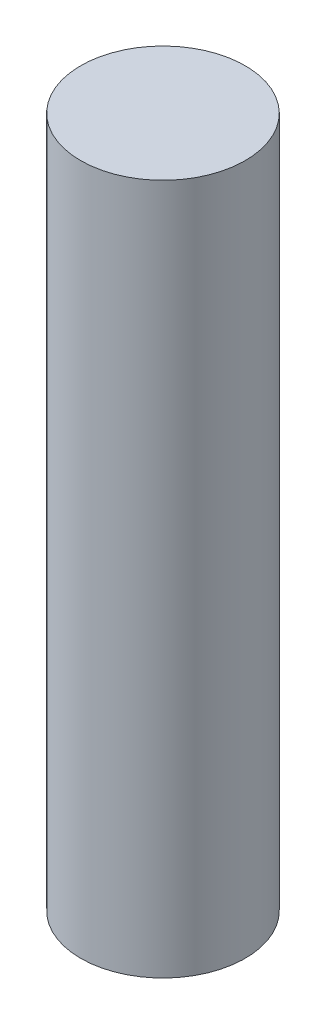
from build123d import *

# Parameters (mm, degrees)
SKETCH1_R           = 4.7625
BOSS_EXTRUDE1_DEPTH = 40


with BuildPart() as part:
    # Sketch1 → Boss-Extrude1 (new body)
    with BuildSketch(Plane(origin=(0, 0, 0), x_dir=(1, 0, 0), z_dir=(0, 1, 0))):
        Circle(SKETCH1_R)
    extrude(amount=BOSS_EXTRUDE1_DEPTH)


solid = part.part
